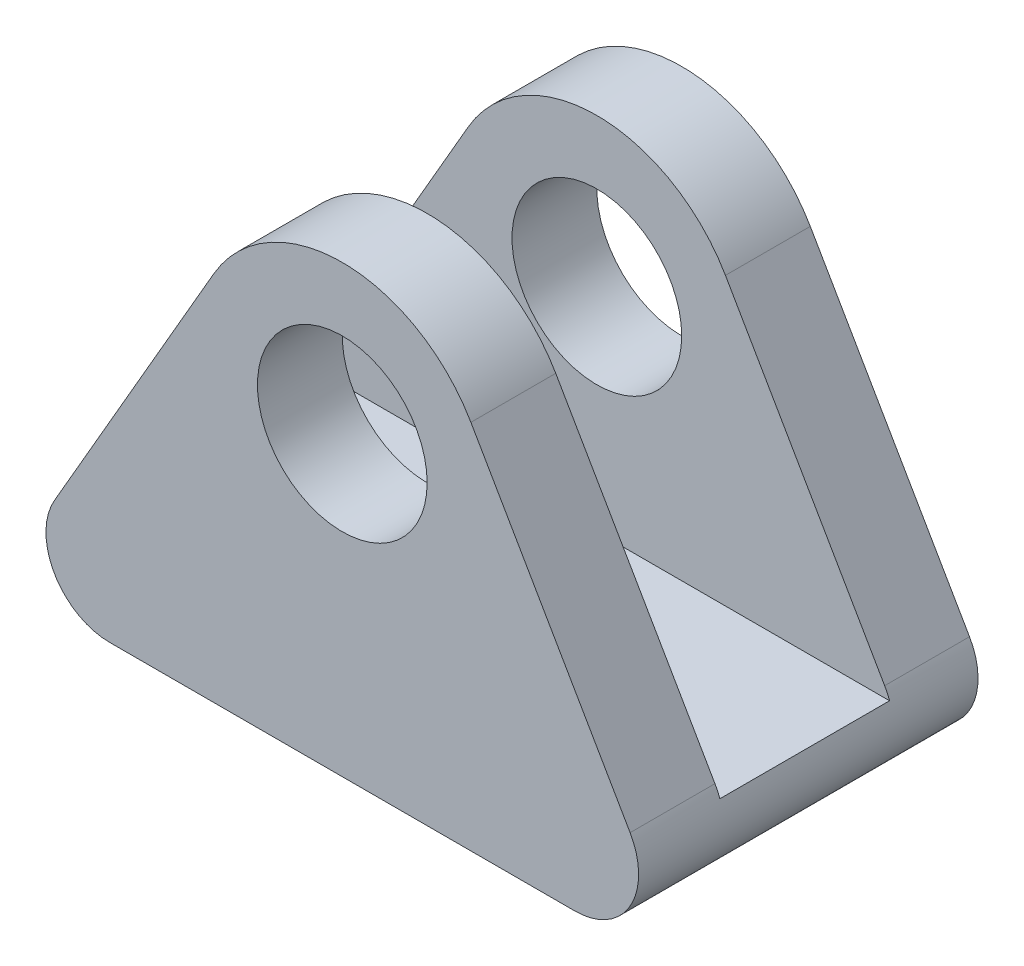
from build123d import *

# Parameters (mm, degrees)
SKETCH1_R           = 4
MAINBODY_DEPTH      = 4
BOSS_EXTRUDE2_DEPTH = 8
FILLET1_R           = 3


with BuildPart() as part:
    # Sketch1 → MainBody (new body)
    with BuildSketch(Plane.XY):
        with BuildLine():
            Line((-6.062177826, 3.5), (-16.165807537, -14))
            Line((-16.165807537, -14), (16.165807537, -14))
            Line((16.165807537, -14), (6.062177826, 3.5))
            ThreePointArc((6.062177826, 3.5), (0, 7), (-6.062177826, 3.5))
        make_face()
        Circle(SKETCH1_R, mode=Mode.SUBTRACT)
    mainbody = extrude(amount=MAINBODY_DEPTH)

    # Sketch3 → Boss-Extrude2 (add)
    with BuildSketch(Plane(origin=(0, 0, 0), x_dir=(-1, 0, 0), z_dir=(0, 0, -1))):
        Polygon((-16.165807537, -14), (-13.856406461, -10), (13.856406461, -10), (16.165807537, -14), align=None)
    extrude(amount=BOSS_EXTRUDE2_DEPTH)

    # Mirror2: MainBody across plane
    add(mainbody.mirror(Plane(origin=(0, 0, -4), x_dir=(1, 0, 0), z_dir=(0, 0, -1))))

    # Fillet1
    # the kernel refuses this fillet: 3 mm, written as the material it takes off along each edge
    with BuildSketch(Plane(origin=(-16.165807537, -14, -24.990381057), x_dir=(1, 0, 0), z_dir=(0, 0, 1)), Plane(origin=(16.165807537, -14, 16.990381057), x_dir=(-1, 0, 0), z_dir=(0, 0, -1))) as fillet1_piece_1:
        with BuildLine():
            CenterArc((FILLET1_R * 1.73205080757, FILLET1_R), FILLET1_R, 150, 120)
            Line((FILLET1_R * 0.866025403784, FILLET1_R * 1.5), (0, 0))
            Line((0, 0), (FILLET1_R * 1.73205080757, 0))
        make_face()
    extrude(amount=41.980762114, mode=Mode.SUBTRACT)


solid = part.part
